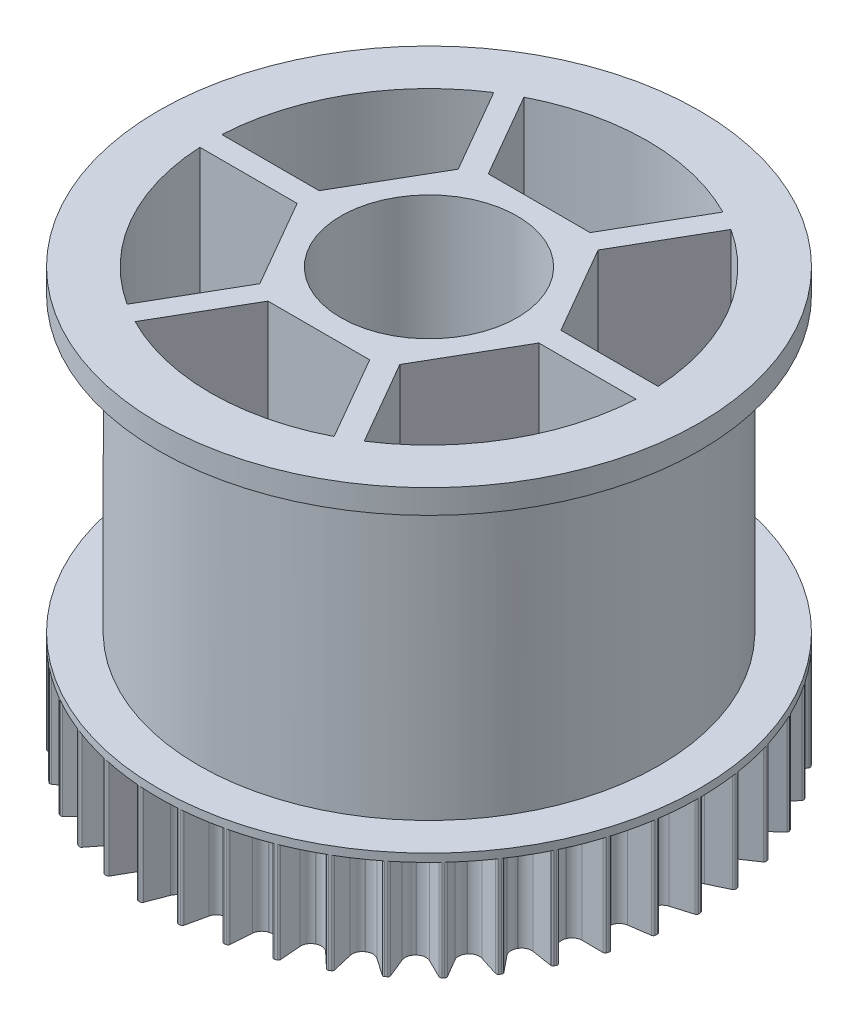
from build123d import *

# Parameters (mm, degrees)
SKETCH_1_R          = 4.4
EXTRUDE_1_DEPTH     = 5
SKETCH_2_R          = 13.5
SKETCH_2_R_2        = 11.2
EXTRUDE_2_DEPTH     = 0.4
SKETCH_2_2_R        = 11.5
SKETCH_2_2_R_2      = 10.9
EXTRUDE_2_2_DEPTH   = 15
SKETCH_5_R          = 13.5
SKETCH_5_R_2        = 10.9
EXTRUDE_3_DEPTH     = 1.2
SKETCH_6_R          = 4.4
EXTRUDE_4_DEPTH     = 8
SKETCH_1_6_R        = 4.4
SKETCH_1_6_R_2      = 3.5
EXTRUDE_5_DEPTH     = 13
SKETCH_1_7_R        = 4.4
SKETCH_1_7_R_2      = 3.5
CUT_EXTRUDE_1_DEPTH = 3
CUT_EXTRUDE_START   = -3
SKETCH_8_R          = 4.4
SKETCH_8_R_2        = 3.5
CUT_EXTRUDE_2_DEPTH = 3
SKETCH_14_R         = 4.4
EXTRUDE_9_DEPTH     = 8.2


with BuildPart() as part:
    # 草图1 → 凸台-拉伸1 (new body)
    with BuildSketch(Plane(origin=(0, 0, 0), x_dir=(1, 0, 0), z_dir=(0, 1, 0))):
        with BuildLine():
            Line((12.421648835, 0.449416948), (13.428727986, 0.146279171))
            ThreePointArc((13.428727986, 0.146279171), (13.480048996, 0.110330314), (13.499904043, 0.050900158))
            ThreePointArc((13.499904043, 0.050900158), (13.5, 0), (13.499904043, -0.050900158))
            ThreePointArc((13.499904043, -0.050900158), (13.480048996, -0.110330314), (13.428727986, -0.146279171))
            Line((13.428727986, -0.146279171), (12.421648835, -0.449416948))
            ThreePointArc((12.421648835, -0.449416948), (12.175747513, -0.615329239), (12.067123529, -0.89136398))
            ThreePointArc((12.067123529, -0.89136398), (12.066165946, -0.904234132), (12.065194637, -0.917103256))
            ThreePointArc((12.065194637, -0.917103256), (12.131464538, -1.206244482), (12.349891401, -1.40695336))
            Line((12.349891401, -1.40695336), (13.300541969, -1.856802698))
            ThreePointArc((13.300541969, -1.856802698), (13.345931866, -1.899999035), (13.356707544, -1.961724646))
            ThreePointArc((13.356707544, -1.961724646), (13.349216154, -2.012070593), (13.341534994, -2.062387937))
            ThreePointArc((13.341534994, -2.062387937), (13.313044106, -2.118195066), (13.256938411, -2.146093404))
            Line((13.256938411, -2.146093404), (12.21592716, -2.295748024))
            ThreePointArc((12.21592716, -2.295748024), (11.948044409, -2.423157522), (11.799492821, -2.679919618))
            ThreePointArc((11.799492821, -2.679919618), (11.796627737, -2.692503301), (11.793749233, -2.705083921))
            ThreePointArc((11.793749233, -2.705083921), (11.816184691, -3.000872694), (12.0022578, -3.231894655))
            Line((12.0022578, -3.231894655), (12.875243823, -3.818406662))
            ThreePointArc((12.875243823, -3.818406662), (12.913688672, -3.867885545), (12.915144269, -3.930527764))
            ThreePointArc((12.915144269, -3.930527764), (12.900232878, -3.979194855), (12.885138099, -4.027805378))
            ThreePointArc((12.885138099, -4.027805378), (12.84864781, -4.07874284), (12.789010738, -4.097967457))
            Line((12.789010738, -4.097967457), (11.737321858, -4.090795883))
            ThreePointArc((11.737321858, -4.090795883), (11.453441736, -4.176856469), (11.268280943, -4.40861028))
            ThreePointArc((11.268280943, -4.40861028), (11.263572359, -4.420626395), (11.258850961, -4.432637481))
            ThreePointArc((11.258850961, -4.432637481), (11.236950804, -4.72846637), (11.386513594, -4.984640763))
            Line((11.386513594, -4.984640763), (12.162334005, -5.694713732))
            ThreePointArc((12.162334005, -5.694713732), (12.192975012, -5.749369884), (12.185078013, -5.811529386))
            ThreePointArc((12.185078013, -5.811529386), (12.163079717, -5.857430478), (12.140908512, -5.903248302))
            ThreePointArc((12.140908512, -5.903248302), (12.097233954, -5.94817824), (12.035397698, -5.958299689))
            Line((12.035397698, -5.958299689), (10.996524182, -5.794462121))
            ThreePointArc((10.996524182, -5.794462121), (10.702988102, -5.837251346), (10.485354288, -6.038819873))
            ThreePointArc((10.485354288, -6.038819873), (10.478907386, -6.05), (10.472448563, -6.061173244))
            ThreePointArc((10.472448563, -6.061173244), (10.406702004, -6.35043392), (10.51641349, -6.626038234))
            Line((10.51641349, -6.626038234), (11.177737743, -7.443810306))
            ThreePointArc((11.177737743, -7.443810306), (11.199890439, -7.5024228), (11.18281725, -7.562711045))
            ThreePointArc((11.18281725, -7.562711045), (11.154223453, -7.604820784), (11.12547109, -7.646822414))
            ThreePointArc((11.12547109, -7.646822414), (11.075587881, -7.684741166), (11.012933761, -7.685533352))
            Line((11.012933761, -7.685533352), (10.010082327, -7.368689651))
            ThreePointArc((10.010082327, -7.368689651), (9.713447399, -7.367251672), (9.468202145, -7.534132209))
            ThreePointArc((9.468202145, -7.534132209), (9.460160938, -7.544226602), (9.452108969, -7.554312413))
            ThreePointArc((9.452108969, -7.554312413), (9.343984679, -7.83054327), (9.411394086, -8.11942096))
            Line((9.411394086, -8.11942096), (9.943449291, -9.026624459))
            ThreePointArc((9.943449291, -9.026624459), (9.956618821, -9.087883988), (9.930750828, -9.144954237))
            ThreePointArc((9.930750828, -9.144954237), (9.89620027, -9.18233196), (9.861509029, -9.219579149))
            ThreePointArc((9.861509029, -9.219579149), (9.806531477, -9.249639674), (9.744459083, -9.241084899))
            Line((9.744459083, -9.241084899), (8.800031773, -8.778312831))
            ThreePointArc((8.800031773, -8.778312831), (8.506924332, -8.732679771), (8.239546012, -8.861144482))
            ThreePointArc((8.239546012, -8.861144482), (8.230090127, -8.869927649), (8.22062488, -8.878700726))
            ThreePointArc((8.22062488, -8.878700726), (8.072538176, -9.135731223), (8.09613969, -9.431429239))
            Line((8.09613969, -9.431429239), (8.487040612, -10.407798738))
            ThreePointArc((8.487040612, -10.407798738), (8.49093279, -10.470336865), (8.456847843, -10.522914262))
            ThreePointArc((8.456847843, -10.522914262), (8.417112325, -10.554725013), (8.377257151, -10.586385721))
            ThreePointArc((8.377257151, -10.586385721), (8.318413365, -10.607916516), (8.258309291, -10.59020588))
            Line((8.258309291, -10.59020588), (7.393403052, -9.991843007))
            ThreePointArc((7.393403052, -9.991843007), (7.110370633, -9.903034234), (6.826832036, -9.990213429))
            ThreePointArc((6.826832036, -9.990213429), (6.816172703, -9.997489169), (6.805505615, -10.004753536))
            ThreePointArc((6.805505615, -10.004753536), (6.620764509, -10.236842037), (6.600030911, -10.532754974))
            Line((6.600030911, -10.532754974), (6.841045471, -11.556479991))
            ThreePointArc((6.841045471, -11.556479991), (6.835573353, -11.618899718), (6.794032851, -11.665809771))
            ThreePointArc((6.794032851, -11.665809771), (6.75, -11.691342951), (6.705871192, -11.716709929))
            ThreePointArc((6.705871192, -11.716709929), (6.644475643, -11.729230032), (6.587682515, -11.702759162))
            Line((6.587682515, -11.702759162), (5.821617923, -10.982171922))
            ThreePointArc((5.821617923, -10.982171922), (5.554983004, -10.852171276), (5.261617913, -10.896117516))
            ThreePointArc((5.261617913, -10.896117516), (5.249993243, -10.901723302), (5.238362601, -10.907316685))
            ThreePointArc((5.238362601, -10.907316685), (5.021093904, -11.109278715), (4.956488349, -11.398796367))
            Line((4.956488349, -11.398796367), (5.042232678, -12.447008578))
            ThreePointArc((5.042232678, -12.447008578), (5.027518502, -12.507915551), (4.979450393, -12.548110367))
            ThreePointArc((4.979450393, -12.548110367), (4.932103829, -12.566795607), (4.884687151, -12.585302199))
            ThreePointArc((4.884687151, -12.585302199), (4.822111316, -12.588531931), (4.769897799, -12.553892142))
            Line((4.769897799, -12.553892142), (4.11978747, -11.727177263))
            ThreePointArc((4.11978747, -11.727177263), (3.875506233, -11.558888745), (3.578867941, -11.558620344))
            ThreePointArc((3.578867941, -11.558620344), (3.56653761, -11.56243095), (3.554203222, -11.566228402))
            ThreePointArc((3.554203222, -11.566228402), (3.309260359, -11.733552465), (3.202226027, -12.010207485))
            Line((3.202226027, -12.010207485), (3.13078474, -13.059491561))
            ThreePointArc((3.13078474, -13.059491561), (3.107157195, -13.117525219), (3.053635241, -13.150106913))
            ThreePointArc((3.053635241, -13.150106913), (3.004032608, -13.161526814), (2.954387271, -13.172759614))
            ThreePointArc((2.954387271, -13.172759614), (2.89202899, -13.166626828), (2.845561447, -13.124591917))
            Line((2.845561447, -13.124591917), (2.325927773, -12.210216843))
            ThreePointArc((2.325927773, -12.210216843), (2.109457058, -12.007399739), (1.816171974, -11.962922693))
            ThreePointArc((1.816171974, -11.962922693), (1.803411421, -11.964852997), (1.790648816, -11.96676969))
            ThreePointArc((1.790648816, -11.96676969), (1.523503405, -12.095718042), (1.376431267, -12.353330415))
            Line((1.376431267, -12.353330415), (1.149400244, -13.380247083))
            ThreePointArc((1.149400244, -13.380247083), (1.117387131, -13.43411105), (1.059606923, -13.4583518))
            ThreePointArc((1.059606923, -13.4583518), (1.008856263, -13.462251262), (0.958091262, -13.465959347))
            ThreePointArc((0.958091262, -13.465959347), (0.897343515, -13.45060104), (0.857659955, -13.402109995))
            Line((0.857659955, -13.402109995), (0.480110693, -12.420500356))
            ThreePointArc((0.480110693, -12.420500356), (0.296286097, -12.187685265), (0.012905725, -12.099993117))
            ThreePointArc((0.012905725, -12.099993117), (0, -12.1), (-0.012905725, -12.099993117))
            ThreePointArc((-0.012905725, -12.099993117), (-0.296286097, -12.187685265), (-0.480110693, -12.420500356))
            Line((-0.480110693, -12.420500356), (-0.857659955, -13.402109995))
            ThreePointArc((-0.857659955, -13.402109995), (-0.897343515, -13.45060104), (-0.958091262, -13.465959347))
            ThreePointArc((-0.958091262, -13.465959347), (-1.008856263, -13.462251262), (-1.059606923, -13.4583518))
            ThreePointArc((-1.059606923, -13.4583518), (-1.117387131, -13.43411105), (-1.149400244, -13.380247083))
            Line((-1.149400244, -13.380247083), (-1.376431267, -12.353330415))
            ThreePointArc((-1.376431267, -12.353330415), (-1.523503405, -12.095718042), (-1.790648816, -11.96676969))
            ThreePointArc((-1.790648816, -11.96676969), (-1.803411421, -11.964852997), (-1.816171974, -11.962922693))
            ThreePointArc((-1.816171974, -11.962922693), (-2.109457058, -12.007399739), (-2.325927773, -12.210216843))
            Line((-2.325927773, -12.210216843), (-2.845561447, -13.124591917))
            ThreePointArc((-2.845561447, -13.124591917), (-2.89202899, -13.166626828), (-2.954387271, -13.172759614))
            ThreePointArc((-2.954387271, -13.172759614), (-3.004032608, -13.161526814), (-3.053635241, -13.150106913))
            ThreePointArc((-3.053635241, -13.150106913), (-3.107157195, -13.117525219), (-3.13078474, -13.059491561))
            Line((-3.13078474, -13.059491561), (-3.202226027, -12.010207485))
            ThreePointArc((-3.202226027, -12.010207485), (-3.309260359, -11.733552465), (-3.554203222, -11.566228402))
            ThreePointArc((-3.554203222, -11.566228402), (-3.56653761, -11.56243095), (-3.578867941, -11.558620344))
            ThreePointArc((-3.578867941, -11.558620344), (-3.875506233, -11.558888745), (-4.11978747, -11.727177263))
            Line((-4.11978747, -11.727177263), (-4.769897799, -12.553892142))
            ThreePointArc((-4.769897799, -12.553892142), (-4.822111316, -12.588531931), (-4.884687151, -12.585302199))
            ThreePointArc((-4.884687151, -12.585302199), (-4.932103829, -12.566795607), (-4.979450393, -12.548110367))
            ThreePointArc((-4.979450393, -12.548110367), (-5.027518502, -12.507915551), (-5.042232678, -12.447008578))
            Line((-5.042232678, -12.447008578), (-4.956488349, -11.398796367))
            ThreePointArc((-4.956488349, -11.398796367), (-5.021093904, -11.109278715), (-5.238362601, -10.907316685))
            ThreePointArc((-5.238362601, -10.907316685), (-5.249993243, -10.901723302), (-5.261617913, -10.896117516))
            ThreePointArc((-5.261617913, -10.896117516), (-5.554983004, -10.852171276), (-5.821617923, -10.982171922))
            Line((-5.821617923, -10.982171922), (-6.587682515, -11.702759162))
            ThreePointArc((-6.587682515, -11.702759162), (-6.644475643, -11.729230032), (-6.705871192, -11.716709929))
            ThreePointArc((-6.705871192, -11.716709929), (-6.75, -11.691342951), (-6.794032851, -11.665809771))
            ThreePointArc((-6.794032851, -11.665809771), (-6.835573353, -11.618899718), (-6.841045471, -11.556479991))
            Line((-6.841045471, -11.556479991), (-6.600030911, -10.532754974))
            ThreePointArc((-6.600030911, -10.532754974), (-6.620764509, -10.236842037), (-6.805505615, -10.004753536))
            ThreePointArc((-6.805505615, -10.004753536), (-6.816172703, -9.997489169), (-6.826832036, -9.990213429))
            ThreePointArc((-6.826832036, -9.990213429), (-7.110370633, -9.903034234), (-7.393403052, -9.991843007))
            Line((-7.393403052, -9.991843007), (-8.258309291, -10.59020588))
            ThreePointArc((-8.258309291, -10.59020588), (-8.318413365, -10.607916516), (-8.377257151, -10.586385721))
            ThreePointArc((-8.377257151, -10.586385721), (-8.417112325, -10.554725013), (-8.456847843, -10.522914262))
            ThreePointArc((-8.456847843, -10.522914262), (-8.49093279, -10.470336865), (-8.487040612, -10.407798738))
            Line((-8.487040612, -10.407798738), (-8.09613969, -9.431429239))
            ThreePointArc((-8.09613969, -9.431429239), (-8.072538176, -9.135731223), (-8.22062488, -8.878700726))
            ThreePointArc((-8.22062488, -8.878700726), (-8.230090127, -8.869927649), (-8.239546012, -8.861144482))
            ThreePointArc((-8.239546012, -8.861144482), (-8.506924332, -8.732679771), (-8.800031773, -8.778312831))
            Line((-8.800031773, -8.778312831), (-9.744459083, -9.241084899))
            ThreePointArc((-9.744459083, -9.241084899), (-9.806531477, -9.249639674), (-9.861509029, -9.219579149))
            ThreePointArc((-9.861509029, -9.219579149), (-9.89620027, -9.18233196), (-9.930750828, -9.144954237))
            ThreePointArc((-9.930750828, -9.144954237), (-9.956618821, -9.087883988), (-9.943449291, -9.026624459))
            Line((-9.943449291, -9.026624459), (-9.411394086, -8.11942096))
            ThreePointArc((-9.411394086, -8.11942096), (-9.343984679, -7.83054327), (-9.452108969, -7.554312413))
            ThreePointArc((-9.452108969, -7.554312413), (-9.460160938, -7.544226602), (-9.468202145, -7.534132209))
            ThreePointArc((-9.468202145, -7.534132209), (-9.713447399, -7.367251672), (-10.010082327, -7.368689651))
            Line((-10.010082327, -7.368689651), (-11.012933761, -7.685533352))
            ThreePointArc((-11.012933761, -7.685533352), (-11.075587881, -7.684741166), (-11.12547109, -7.646822414))
            ThreePointArc((-11.12547109, -7.646822414), (-11.154223453, -7.604820784), (-11.18281725, -7.562711045))
            ThreePointArc((-11.18281725, -7.562711045), (-11.199890439, -7.5024228), (-11.177737743, -7.443810306))
            Line((-11.177737743, -7.443810306), (-10.51641349, -6.626038234))
            ThreePointArc((-10.51641349, -6.626038234), (-10.406702004, -6.35043392), (-10.472448563, -6.061173244))
            ThreePointArc((-10.472448563, -6.061173244), (-10.478907386, -6.05), (-10.485354288, -6.038819873))
            ThreePointArc((-10.485354288, -6.038819873), (-10.702988102, -5.837251346), (-10.996524182, -5.794462121))
            Line((-10.996524182, -5.794462121), (-12.035397698, -5.958299689))
            ThreePointArc((-12.035397698, -5.958299689), (-12.097233954, -5.94817824), (-12.140908512, -5.903248302))
            ThreePointArc((-12.140908512, -5.903248302), (-12.163079717, -5.857430478), (-12.185078013, -5.811529386))
            ThreePointArc((-12.185078013, -5.811529386), (-12.192975012, -5.749369884), (-12.162334005, -5.694713732))
            Line((-12.162334005, -5.694713732), (-11.386513594, -4.984640763))
            ThreePointArc((-11.386513594, -4.984640763), (-11.236950804, -4.72846637), (-11.258850961, -4.432637481))
            ThreePointArc((-11.258850961, -4.432637481), (-11.263572359, -4.420626395), (-11.268280943, -4.40861028))
            ThreePointArc((-11.268280943, -4.40861028), (-11.453441736, -4.176856469), (-11.737321858, -4.090795883))
            Line((-11.737321858, -4.090795883), (-12.789010738, -4.097967457))
            ThreePointArc((-12.789010738, -4.097967457), (-12.84864781, -4.07874284), (-12.885138099, -4.027805378))
            ThreePointArc((-12.885138099, -4.027805378), (-12.900232878, -3.979194855), (-12.915144269, -3.930527764))
            ThreePointArc((-12.915144269, -3.930527764), (-12.913688672, -3.867885545), (-12.875243823, -3.818406662))
            Line((-12.875243823, -3.818406662), (-12.0022578, -3.231894655))
            ThreePointArc((-12.0022578, -3.231894655), (-11.816184691, -3.000872694), (-11.793749233, -2.705083921))
            ThreePointArc((-11.793749233, -2.705083921), (-11.796627737, -2.692503301), (-11.799492821, -2.679919618))
            ThreePointArc((-11.799492821, -2.679919618), (-11.948044409, -2.423157522), (-12.21592716, -2.295748024))
            Line((-12.21592716, -2.295748024), (-13.256938411, -2.146093404))
            ThreePointArc((-13.256938411, -2.146093404), (-13.313044106, -2.118195066), (-13.341534994, -2.062387937))
            ThreePointArc((-13.341534994, -2.062387937), (-13.349216154, -2.012070593), (-13.356707544, -1.961724646))
            ThreePointArc((-13.356707544, -1.961724646), (-13.345931866, -1.899999035), (-13.300541969, -1.856802698))
            Line((-13.300541969, -1.856802698), (-12.349891401, -1.40695336))
            ThreePointArc((-12.349891401, -1.40695336), (-12.131464538, -1.206244482), (-12.065194637, -0.917103256))
            ThreePointArc((-12.065194637, -0.917103256), (-12.066165946, -0.904234132), (-12.067123529, -0.89136398))
            ThreePointArc((-12.067123529, -0.89136398), (-12.175747513, -0.615329239), (-12.421648835, -0.449416948))
            Line((-12.421648835, -0.449416948), (-13.428727986, -0.146279171))
            ThreePointArc((-13.428727986, -0.146279171), (-13.480048996, -0.110330314), (-13.499904043, -0.050900158))
            ThreePointArc((-13.499904043, -0.050900158), (-13.5, 0), (-13.499904043, 0.050900158))
            ThreePointArc((-13.499904043, 0.050900158), (-13.480048996, 0.110330314), (-13.428727986, 0.146279171))
            Line((-13.428727986, 0.146279171), (-12.421648835, 0.449416948))
            ThreePointArc((-12.421648835, 0.449416948), (-12.175747513, 0.615329239), (-12.067123529, 0.89136398))
            ThreePointArc((-12.067123529, 0.89136398), (-12.066165946, 0.904234132), (-12.065194637, 0.917103256))
            ThreePointArc((-12.065194637, 0.917103256), (-12.131464538, 1.206244482), (-12.349891401, 1.40695336))
            Line((-12.349891401, 1.40695336), (-13.300541969, 1.856802698))
            ThreePointArc((-13.300541969, 1.856802698), (-13.345931866, 1.899999035), (-13.356707544, 1.961724646))
            ThreePointArc((-13.356707544, 1.961724646), (-13.349216154, 2.012070593), (-13.341534994, 2.062387937))
            ThreePointArc((-13.341534994, 2.062387937), (-13.313044106, 2.118195066), (-13.256938411, 2.146093404))
            Line((-13.256938411, 2.146093404), (-12.21592716, 2.295748024))
            ThreePointArc((-12.21592716, 2.295748024), (-11.948044409, 2.423157522), (-11.799492821, 2.679919618))
            ThreePointArc((-11.799492821, 2.679919618), (-11.796627737, 2.692503301), (-11.793749233, 2.705083921))
            ThreePointArc((-11.793749233, 2.705083921), (-11.816184691, 3.000872694), (-12.0022578, 3.231894655))
            Line((-12.0022578, 3.231894655), (-12.875243823, 3.818406662))
            ThreePointArc((-12.875243823, 3.818406662), (-12.913688672, 3.867885545), (-12.915144269, 3.930527764))
            ThreePointArc((-12.915144269, 3.930527764), (-12.900232878, 3.979194855), (-12.885138099, 4.027805378))
            ThreePointArc((-12.885138099, 4.027805378), (-12.84864781, 4.07874284), (-12.789010738, 4.097967457))
            Line((-12.789010738, 4.097967457), (-11.737321858, 4.090795883))
            ThreePointArc((-11.737321858, 4.090795883), (-11.453441736, 4.176856469), (-11.268280943, 4.40861028))
            ThreePointArc((-11.268280943, 4.40861028), (-11.263572359, 4.420626395), (-11.258850961, 4.432637481))
            ThreePointArc((-11.258850961, 4.432637481), (-11.236950804, 4.72846637), (-11.386513594, 4.984640763))
            Line((-11.386513594, 4.984640763), (-12.162334005, 5.694713732))
            ThreePointArc((-12.162334005, 5.694713732), (-12.192975012, 5.749369884), (-12.185078013, 5.811529386))
            ThreePointArc((-12.185078013, 5.811529386), (-12.163079717, 5.857430478), (-12.140908512, 5.903248302))
            ThreePointArc((-12.140908512, 5.903248302), (-12.097233954, 5.94817824), (-12.035397698, 5.958299689))
            Line((-12.035397698, 5.958299689), (-10.996524182, 5.794462121))
            ThreePointArc((-10.996524182, 5.794462121), (-10.702988102, 5.837251346), (-10.485354288, 6.038819873))
            ThreePointArc((-10.485354288, 6.038819873), (-10.478907386, 6.05), (-10.472448563, 6.061173244))
            ThreePointArc((-10.472448563, 6.061173244), (-10.406702004, 6.35043392), (-10.51641349, 6.626038234))
            Line((-10.51641349, 6.626038234), (-11.177737743, 7.443810306))
            ThreePointArc((-11.177737743, 7.443810306), (-11.199890439, 7.5024228), (-11.18281725, 7.562711045))
            ThreePointArc((-11.18281725, 7.562711045), (-11.154223453, 7.604820784), (-11.12547109, 7.646822414))
            ThreePointArc((-11.12547109, 7.646822414), (-11.075587881, 7.684741166), (-11.012933761, 7.685533352))
            Line((-11.012933761, 7.685533352), (-10.010082327, 7.368689651))
            ThreePointArc((-10.010082327, 7.368689651), (-9.713447399, 7.367251672), (-9.468202145, 7.534132209))
            ThreePointArc((-9.468202145, 7.534132209), (-9.460160938, 7.544226602), (-9.452108969, 7.554312413))
            ThreePointArc((-9.452108969, 7.554312413), (-9.343984679, 7.83054327), (-9.411394086, 8.11942096))
            Line((-9.411394086, 8.11942096), (-9.943449291, 9.026624459))
            ThreePointArc((-9.943449291, 9.026624459), (-9.956618821, 9.087883988), (-9.930750828, 9.144954237))
            ThreePointArc((-9.930750828, 9.144954237), (-9.89620027, 9.18233196), (-9.861509029, 9.219579149))
            ThreePointArc((-9.861509029, 9.219579149), (-9.806531477, 9.249639674), (-9.744459083, 9.241084899))
            Line((-9.744459083, 9.241084899), (-8.800031773, 8.778312831))
            ThreePointArc((-8.800031773, 8.778312831), (-8.506924332, 8.732679771), (-8.239546012, 8.861144482))
            ThreePointArc((-8.239546012, 8.861144482), (-8.230090127, 8.869927649), (-8.22062488, 8.878700726))
            ThreePointArc((-8.22062488, 8.878700726), (-8.072538176, 9.135731223), (-8.09613969, 9.431429239))
            Line((-8.09613969, 9.431429239), (-8.487040612, 10.407798738))
            ThreePointArc((-8.487040612, 10.407798738), (-8.49093279, 10.470336865), (-8.456847843, 10.522914262))
            ThreePointArc((-8.456847843, 10.522914262), (-8.417112325, 10.554725013), (-8.377257151, 10.586385721))
            ThreePointArc((-8.377257151, 10.586385721), (-8.318413365, 10.607916516), (-8.258309291, 10.59020588))
            Line((-8.258309291, 10.59020588), (-7.393403052, 9.991843007))
            ThreePointArc((-7.393403052, 9.991843007), (-7.110370633, 9.903034234), (-6.826832036, 9.990213429))
            ThreePointArc((-6.826832036, 9.990213429), (-6.816172703, 9.997489169), (-6.805505615, 10.004753536))
            ThreePointArc((-6.805505615, 10.004753536), (-6.620764509, 10.236842037), (-6.600030911, 10.532754974))
            Line((-6.600030911, 10.532754974), (-6.841045471, 11.556479991))
            ThreePointArc((-6.841045471, 11.556479991), (-6.835573353, 11.618899718), (-6.794032851, 11.665809771))
            ThreePointArc((-6.794032851, 11.665809771), (-6.75, 11.691342951), (-6.705871192, 11.716709929))
            ThreePointArc((-6.705871192, 11.716709929), (-6.644475643, 11.729230032), (-6.587682515, 11.702759162))
            Line((-6.587682515, 11.702759162), (-5.821617923, 10.982171922))
            ThreePointArc((-5.821617923, 10.982171922), (-5.554983004, 10.852171276), (-5.261617913, 10.896117516))
            ThreePointArc((-5.261617913, 10.896117516), (-5.249993243, 10.901723302), (-5.238362601, 10.907316685))
            ThreePointArc((-5.238362601, 10.907316685), (-5.021093904, 11.109278715), (-4.956488349, 11.398796367))
            Line((-4.956488349, 11.398796367), (-5.042232678, 12.447008578))
            ThreePointArc((-5.042232678, 12.447008578), (-5.027518502, 12.507915551), (-4.979450393, 12.548110367))
            ThreePointArc((-4.979450393, 12.548110367), (-4.932103829, 12.566795607), (-4.884687151, 12.585302199))
            ThreePointArc((-4.884687151, 12.585302199), (-4.822111316, 12.588531931), (-4.769897799, 12.553892142))
            Line((-4.769897799, 12.553892142), (-4.11978747, 11.727177263))
            ThreePointArc((-4.11978747, 11.727177263), (-3.875506233, 11.558888745), (-3.578867941, 11.558620344))
            ThreePointArc((-3.578867941, 11.558620344), (-3.56653761, 11.56243095), (-3.554203222, 11.566228402))
            ThreePointArc((-3.554203222, 11.566228402), (-3.309260359, 11.733552465), (-3.202226027, 12.010207485))
            Line((-3.202226027, 12.010207485), (-3.13078474, 13.059491561))
            ThreePointArc((-3.13078474, 13.059491561), (-3.107157195, 13.117525219), (-3.053635241, 13.150106913))
            ThreePointArc((-3.053635241, 13.150106913), (-3.004032608, 13.161526814), (-2.954387271, 13.172759614))
            ThreePointArc((-2.954387271, 13.172759614), (-2.89202899, 13.166626828), (-2.845561447, 13.124591917))
            Line((-2.845561447, 13.124591917), (-2.325927773, 12.210216843))
            ThreePointArc((-2.325927773, 12.210216843), (-2.109457058, 12.007399739), (-1.816171974, 11.962922693))
            ThreePointArc((-1.816171974, 11.962922693), (-1.803411421, 11.964852997), (-1.790648816, 11.96676969))
            ThreePointArc((-1.790648816, 11.96676969), (-1.523503405, 12.095718042), (-1.376431267, 12.353330415))
            Line((-1.376431267, 12.353330415), (-1.149400244, 13.380247083))
            ThreePointArc((-1.149400244, 13.380247083), (-1.117387131, 13.43411105), (-1.059606923, 13.4583518))
            ThreePointArc((-1.059606923, 13.4583518), (-1.008856263, 13.462251262), (-0.958091262, 13.465959347))
            ThreePointArc((-0.958091262, 13.465959347), (-0.897343515, 13.45060104), (-0.857659955, 13.402109995))
            Line((-0.857659955, 13.402109995), (-0.480110693, 12.420500356))
            ThreePointArc((-0.480110693, 12.420500356), (-0.296286097, 12.187685265), (-0.012905725, 12.099993117))
            ThreePointArc((-0.012905725, 12.099993117), (0, 12.1), (0.012905725, 12.099993117))
            ThreePointArc((0.012905725, 12.099993117), (0.296286097, 12.187685265), (0.480110693, 12.420500356))
            Line((0.480110693, 12.420500356), (0.857659955, 13.402109995))
            ThreePointArc((0.857659955, 13.402109995), (0.897343515, 13.45060104), (0.958091262, 13.465959347))
            ThreePointArc((0.958091262, 13.465959347), (1.008856263, 13.462251262), (1.059606923, 13.4583518))
            ThreePointArc((1.059606923, 13.4583518), (1.117387131, 13.43411105), (1.149400244, 13.380247083))
            Line((1.149400244, 13.380247083), (1.376431267, 12.353330415))
            ThreePointArc((1.376431267, 12.353330415), (1.523503405, 12.095718042), (1.790648816, 11.96676969))
            ThreePointArc((1.790648816, 11.96676969), (1.803411421, 11.964852997), (1.816171974, 11.962922693))
            ThreePointArc((1.816171974, 11.962922693), (2.109457058, 12.007399739), (2.325927773, 12.210216843))
            Line((2.325927773, 12.210216843), (2.845561447, 13.124591917))
            ThreePointArc((2.845561447, 13.124591917), (2.89202899, 13.166626828), (2.954387271, 13.172759614))
            ThreePointArc((2.954387271, 13.172759614), (3.004032608, 13.161526814), (3.053635241, 13.150106913))
            ThreePointArc((3.053635241, 13.150106913), (3.107157195, 13.117525219), (3.13078474, 13.059491561))
            Line((3.13078474, 13.059491561), (3.202226027, 12.010207485))
            ThreePointArc((3.202226027, 12.010207485), (3.309260359, 11.733552465), (3.554203222, 11.566228402))
            ThreePointArc((3.554203222, 11.566228402), (3.56653761, 11.56243095), (3.578867941, 11.558620344))
            ThreePointArc((3.578867941, 11.558620344), (3.875506233, 11.558888745), (4.11978747, 11.727177263))
            Line((4.11978747, 11.727177263), (4.769897799, 12.553892142))
            ThreePointArc((4.769897799, 12.553892142), (4.822111316, 12.588531931), (4.884687151, 12.585302199))
            ThreePointArc((4.884687151, 12.585302199), (4.932103829, 12.566795607), (4.979450393, 12.548110367))
            ThreePointArc((4.979450393, 12.548110367), (5.027518502, 12.507915551), (5.042232678, 12.447008578))
            Line((5.042232678, 12.447008578), (4.956488349, 11.398796367))
            ThreePointArc((4.956488349, 11.398796367), (5.021093904, 11.109278715), (5.238362601, 10.907316685))
            ThreePointArc((5.238362601, 10.907316685), (5.249993243, 10.901723302), (5.261617913, 10.896117516))
            ThreePointArc((5.261617913, 10.896117516), (5.554983004, 10.852171276), (5.821617923, 10.982171922))
            Line((5.821617923, 10.982171922), (6.587682515, 11.702759162))
            ThreePointArc((6.587682515, 11.702759162), (6.644475643, 11.729230032), (6.705871192, 11.716709929))
            ThreePointArc((6.705871192, 11.716709929), (6.75, 11.691342951), (6.794032851, 11.665809771))
            ThreePointArc((6.794032851, 11.665809771), (6.835573353, 11.618899718), (6.841045471, 11.556479991))
            Line((6.841045471, 11.556479991), (6.600030911, 10.532754974))
            ThreePointArc((6.600030911, 10.532754974), (6.620764509, 10.236842037), (6.805505615, 10.004753536))
            ThreePointArc((6.805505615, 10.004753536), (6.816172703, 9.997489169), (6.826832036, 9.990213429))
            ThreePointArc((6.826832036, 9.990213429), (7.110370633, 9.903034234), (7.393403052, 9.991843007))
            Line((7.393403052, 9.991843007), (8.258309291, 10.59020588))
            ThreePointArc((8.258309291, 10.59020588), (8.318413365, 10.607916516), (8.377257151, 10.586385721))
            ThreePointArc((8.377257151, 10.586385721), (8.417112325, 10.554725013), (8.456847843, 10.522914262))
            ThreePointArc((8.456847843, 10.522914262), (8.49093279, 10.470336865), (8.487040612, 10.407798738))
            Line((8.487040612, 10.407798738), (8.09613969, 9.431429239))
            ThreePointArc((8.09613969, 9.431429239), (8.072538176, 9.135731223), (8.22062488, 8.878700726))
            ThreePointArc((8.22062488, 8.878700726), (8.230090127, 8.869927649), (8.239546012, 8.861144482))
            ThreePointArc((8.239546012, 8.861144482), (8.506924332, 8.732679771), (8.800031773, 8.778312831))
            Line((8.800031773, 8.778312831), (9.744459083, 9.241084899))
            ThreePointArc((9.744459083, 9.241084899), (9.806531477, 9.249639674), (9.861509029, 9.219579149))
            ThreePointArc((9.861509029, 9.219579149), (9.89620027, 9.18233196), (9.930750828, 9.144954237))
            ThreePointArc((9.930750828, 9.144954237), (9.956618821, 9.087883988), (9.943449291, 9.026624459))
            Line((9.943449291, 9.026624459), (9.411394086, 8.11942096))
            ThreePointArc((9.411394086, 8.11942096), (9.343984679, 7.83054327), (9.452108969, 7.554312413))
            ThreePointArc((9.452108969, 7.554312413), (9.460160938, 7.544226602), (9.468202145, 7.534132209))
            ThreePointArc((9.468202145, 7.534132209), (9.713447399, 7.367251672), (10.010082327, 7.368689651))
            Line((10.010082327, 7.368689651), (11.012933761, 7.685533352))
            ThreePointArc((11.012933761, 7.685533352), (11.075587881, 7.684741166), (11.12547109, 7.646822414))
            ThreePointArc((11.12547109, 7.646822414), (11.154223453, 7.604820784), (11.18281725, 7.562711045))
            ThreePointArc((11.18281725, 7.562711045), (11.199890439, 7.5024228), (11.177737743, 7.443810306))
            Line((11.177737743, 7.443810306), (10.51641349, 6.626038234))
            ThreePointArc((10.51641349, 6.626038234), (10.406702004, 6.35043392), (10.472448563, 6.061173244))
            ThreePointArc((10.472448563, 6.061173244), (10.478907386, 6.05), (10.485354288, 6.038819873))
            ThreePointArc((10.485354288, 6.038819873), (10.702988102, 5.837251346), (10.996524182, 5.794462121))
            Line((10.996524182, 5.794462121), (12.035397698, 5.958299689))
            ThreePointArc((12.035397698, 5.958299689), (12.097233954, 5.94817824), (12.140908512, 5.903248302))
            ThreePointArc((12.140908512, 5.903248302), (12.163079717, 5.857430478), (12.185078013, 5.811529386))
            ThreePointArc((12.185078013, 5.811529386), (12.192975012, 5.749369884), (12.162334005, 5.694713732))
            Line((12.162334005, 5.694713732), (11.386513594, 4.984640763))
            ThreePointArc((11.386513594, 4.984640763), (11.236950804, 4.72846637), (11.258850961, 4.432637481))
            ThreePointArc((11.258850961, 4.432637481), (11.263572359, 4.420626395), (11.268280943, 4.40861028))
            ThreePointArc((11.268280943, 4.40861028), (11.453441736, 4.176856469), (11.737321858, 4.090795883))
            Line((11.737321858, 4.090795883), (12.789010738, 4.097967457))
            ThreePointArc((12.789010738, 4.097967457), (12.84864781, 4.07874284), (12.885138099, 4.027805378))
            ThreePointArc((12.885138099, 4.027805378), (12.900232878, 3.979194855), (12.915144269, 3.930527764))
            ThreePointArc((12.915144269, 3.930527764), (12.913688672, 3.867885545), (12.875243823, 3.818406662))
            Line((12.875243823, 3.818406662), (12.0022578, 3.231894655))
            ThreePointArc((12.0022578, 3.231894655), (11.816184691, 3.000872694), (11.793749233, 2.705083921))
            ThreePointArc((11.793749233, 2.705083921), (11.796627737, 2.692503301), (11.799492821, 2.679919618))
            ThreePointArc((11.799492821, 2.679919618), (11.948044409, 2.423157522), (12.21592716, 2.295748024))
            Line((12.21592716, 2.295748024), (13.256938411, 2.146093404))
            ThreePointArc((13.256938411, 2.146093404), (13.313044106, 2.118195066), (13.341534994, 2.062387937))
            ThreePointArc((13.341534994, 2.062387937), (13.349216154, 2.012070593), (13.356707544, 1.961724646))
            ThreePointArc((13.356707544, 1.961724646), (13.345931866, 1.899999035), (13.300541969, 1.856802698))
            Line((13.300541969, 1.856802698), (12.349891401, 1.40695336))
            ThreePointArc((12.349891401, 1.40695336), (12.131464538, 1.206244482), (12.065194637, 0.917103256))
            ThreePointArc((12.065194637, 0.917103256), (12.066165946, 0.904234132), (12.067123529, 0.89136398))
            ThreePointArc((12.067123529, 0.89136398), (12.175747513, 0.615329239), (12.421648835, 0.449416948))
        make_face()
        with Locations(Location((0, 0, 0), (0, 0, 270))):
            Circle(SKETCH_1_R, mode=Mode.SUBTRACT)
        with BuildLine():
            Line((3.492969129, -4.95), (6.033310313, -0.55))
            Line((6.033310313, -0.55), (11.186487384, -0.55))
            ThreePointArc((11.186487384, -0.55), (9.699484522, -5.6), (6.069557664, -9.412782254))
            Line((6.069557664, -9.412782254), (3.492969129, -4.95))
        make_face(mode=Mode.SUBTRACT)
        with BuildLine():
            Line((2.540341184, -5.5), (-2.540341184, -5.5))
            Line((-2.540341184, -5.5), (-5.11692972, -9.962782254))
            ThreePointArc((-5.11692972, -9.962782254), (0, -11.2), (5.11692972, -9.962782254))
            Line((5.11692972, -9.962782254), (2.540341184, -5.5))
        make_face(mode=Mode.SUBTRACT)
        with BuildLine():
            Line((-3.492969129, -4.95), (-6.033310313, -0.55))
            Line((-6.033310313, -0.55), (-11.186487384, -0.55))
            ThreePointArc((-11.186487384, -0.55), (-9.699484522, -5.6), (-6.069557664, -9.412782254))
            Line((-6.069557664, -9.412782254), (-3.492969129, -4.95))
        make_face(mode=Mode.SUBTRACT)
        with BuildLine():
            Line((6.033310313, 0.55), (11.186487384, 0.55))
            ThreePointArc((11.186487384, 0.55), (9.699484522, 5.6), (6.069557664, 9.412782254))
            Line((6.069557664, 9.412782254), (3.492969129, 4.95))
            Line((3.492969129, 4.95), (6.033310313, 0.55))
        make_face(mode=Mode.SUBTRACT)
        with BuildLine():
            Line((-6.033310313, 0.55), (-11.186487384, 0.55))
            ThreePointArc((-11.186487384, 0.55), (-9.699484522, 5.6), (-6.069557664, 9.412782254))
            Line((-6.069557664, 9.412782254), (-3.492969129, 4.95))
            Line((-3.492969129, 4.95), (-6.033310313, 0.55))
        make_face(mode=Mode.SUBTRACT)
        with BuildLine():
            Line((-2.540341184, 5.5), (-5.11692972, 9.962782254))
            ThreePointArc((-5.11692972, 9.962782254), (0, 11.2), (5.11692972, 9.962782254))
            Line((5.11692972, 9.962782254), (2.540341184, 5.5))
            Line((2.540341184, 5.5), (-2.540341184, 5.5))
        make_face(mode=Mode.SUBTRACT)
    extrude(amount=EXTRUDE_1_DEPTH)

    # 草图2 → Extrude 2 (add)
    with BuildSketch(Plane(origin=(0, 5, 0), x_dir=(1, 0, 0), z_dir=(0, 1, 0))):
        with Locations(Location((0, 0, 0), (0, 0, 94.069686794))):
            Circle(SKETCH_2_R)
        with Locations(Location((0, 0, 0), (0, 0, 117.18523589))):
            Circle(SKETCH_2_R_2, mode=Mode.SUBTRACT)
    extrude(amount=EXTRUDE_2_DEPTH)

    # 草图2<2> → Extrude 2 2 (add)
    with BuildSketch(Plane(origin=(0, 5, 0), x_dir=(1, 0, 0), z_dir=(0, 1, 0))):
        Circle(SKETCH_2_2_R)
        Circle(SKETCH_2_2_R_2, mode=Mode.SUBTRACT)
    extrude(amount=EXTRUDE_2_2_DEPTH)

    # 草图5 → 凸台-拉伸3 (add)
    with BuildSketch(Plane(origin=(0, 20, 0), x_dir=(1, 0, 0), z_dir=(0, 1, 0))):
        with Locations(Location((0, 0, 0), (0, 0, 94.069686794))):
            Circle(SKETCH_5_R)
        with Locations(Location((0, 0, 0), (0, 0, 117.107700331))):
            Circle(SKETCH_5_R_2, mode=Mode.SUBTRACT)
    extrude(amount=EXTRUDE_3_DEPTH)

    # 草图6 → 凸台-拉伸4 (add)
    with BuildSketch(Plane(origin=(0, 5, 0), x_dir=(1, 0, 0), z_dir=(0, 1, 0))):
        with BuildLine():
            Line((-4.966743533, -9.702652147), (-2.540341184, -5.5))
            Line((-2.540341184, -5.5), (2.540341184, -5.5))
            Line((2.540341184, -5.5), (4.966743533, -9.702652147))
            ThreePointArc((4.966743533, -9.702652147), (5.45, -9.439676901), (5.919371477, -9.152652147))
            Line((5.919371477, -9.152652147), (3.492969129, -4.95))
            Line((3.492969129, -4.95), (6.033310313, -0.55))
            Line((6.033310313, -0.55), (10.886115009, -0.55))
            ThreePointArc((10.886115009, -0.55), (10.9, 0), (10.886115009, 0.55))
            Line((10.886115009, 0.55), (6.033310313, 0.55))
            Line((6.033310313, 0.55), (3.492969129, 4.95))
            Line((3.492969129, 4.95), (5.919371477, 9.152652147))
            ThreePointArc((5.919371477, 9.152652147), (5.45, 9.439676901), (4.966743533, 9.702652147))
            Line((4.966743533, 9.702652147), (2.540341184, 5.5))
            Line((2.540341184, 5.5), (-2.540341184, 5.5))
            Line((-2.540341184, 5.5), (-4.966743533, 9.702652147))
            ThreePointArc((-4.966743533, 9.702652147), (-5.45, 9.439676901), (-5.919371477, 9.152652147))
            Line((-5.919371477, 9.152652147), (-3.492969129, 4.95))
            Line((-3.492969129, 4.95), (-6.033310313, 0.55))
            Line((-6.033310313, 0.55), (-10.886115009, 0.55))
            ThreePointArc((-10.886115009, 0.55), (-10.9, 0), (-10.886115009, -0.55))
            Line((-10.886115009, -0.55), (-6.033310313, -0.55))
            Line((-6.033310313, -0.55), (-3.492969129, -4.95))
            Line((-3.492969129, -4.95), (-5.919371477, -9.152652147))
            ThreePointArc((-5.919371477, -9.152652147), (-5.45, -9.439676901), (-4.966743533, -9.702652147))
        make_face()
        with Locations(Location((0, 0, 0), (0, 0, 270))):
            Circle(SKETCH_6_R, mode=Mode.SUBTRACT)
    extrude(amount=EXTRUDE_4_DEPTH)

    # 草图1<6> → 凸台-拉伸5 (add)
    with BuildSketch(Plane(origin=(0, 0, 0), x_dir=(1, 0, 0), z_dir=(0, 1, 0))):
        Circle(SKETCH_1_6_R)
        with Locations(Location((0, 0, 0), (0, 0, 270))):
            Circle(SKETCH_1_6_R_2, mode=Mode.SUBTRACT)
    extrude(amount=EXTRUDE_5_DEPTH)

    # 草图1<7> → 切除-拉伸1 (cut)
    with BuildSketch(Plane(origin=(0, 0, 0), x_dir=(1, 0, 0), z_dir=(0, 1, 0))):
        with Locations(Location((0, 0, 0), (0, 0, 270))):
            Circle(SKETCH_1_7_R)
        with Locations(Location((0, 0, 0), (0, 0, 270))):
            Circle(SKETCH_1_7_R_2, mode=Mode.SUBTRACT)
    extrude(amount=CUT_EXTRUDE_1_DEPTH, mode=Mode.SUBTRACT)

    # 草图8 → 切除-拉伸2 (cut)
    with BuildSketch(Plane(origin=(0, 13, 0), x_dir=(1, 0, 0), z_dir=(0, 1, 0)).offset(CUT_EXTRUDE_START)):
        with Locations(Location((0, 0, 0), (0, 0, 270))):
            Circle(SKETCH_8_R)
        with Locations(Location((0, 0, 0), (0, 0, 270))):
            Circle(SKETCH_8_R_2, mode=Mode.SUBTRACT)
    extrude(amount=CUT_EXTRUDE_2_DEPTH, mode=Mode.SUBTRACT)

    # 草图14 → 凸台-拉伸9 (add)
    with BuildSketch(Plane(origin=(0, 13, 0), x_dir=(1, 0, 0), z_dir=(0, 1, 0))):
        with BuildLine():
            Line((-4.966743533, -9.702652147), (-2.540341184, -5.5))
            Line((-2.540341184, -5.5), (2.540341184, -5.5))
            Line((2.540341184, -5.5), (4.966743533, -9.702652147))
            ThreePointArc((4.966743533, -9.702652147), (5.45, -9.439676901), (5.919371477, -9.152652147))
            Line((5.919371477, -9.152652147), (3.492969129, -4.95))
            Line((3.492969129, -4.95), (6.033310313, -0.55))
            Line((6.033310313, -0.55), (10.886115009, -0.55))
            ThreePointArc((10.886115009, -0.55), (10.9, 0), (10.886115009, 0.55))
            Line((10.886115009, 0.55), (6.033310313, 0.55))
            Line((6.033310313, 0.55), (3.492969129, 4.95))
            Line((3.492969129, 4.95), (5.919371477, 9.152652147))
            ThreePointArc((5.919371477, 9.152652147), (5.45, 9.439676901), (4.966743533, 9.702652147))
            Line((4.966743533, 9.702652147), (2.540341184, 5.5))
            Line((2.540341184, 5.5), (-2.540341184, 5.5))
            Line((-2.540341184, 5.5), (-4.966743533, 9.702652147))
            ThreePointArc((-4.966743533, 9.702652147), (-5.45, 9.439676901), (-5.919371477, 9.152652147))
            Line((-5.919371477, 9.152652147), (-3.492969129, 4.95))
            Line((-3.492969129, 4.95), (-6.033310313, 0.55))
            Line((-6.033310313, 0.55), (-10.886115009, 0.55))
            ThreePointArc((-10.886115009, 0.55), (-10.9, 0), (-10.886115009, -0.55))
            Line((-10.886115009, -0.55), (-6.033310313, -0.55))
            Line((-6.033310313, -0.55), (-3.492969129, -4.95))
            Line((-3.492969129, -4.95), (-5.919371477, -9.152652147))
            ThreePointArc((-5.919371477, -9.152652147), (-5.45, -9.439676901), (-4.966743533, -9.702652147))
        make_face()
        with Locations(Location((0, 0, 0), (0, 0, 270))):
            Circle(SKETCH_14_R, mode=Mode.SUBTRACT)
    extrude(amount=EXTRUDE_9_DEPTH)


solid = part.part
